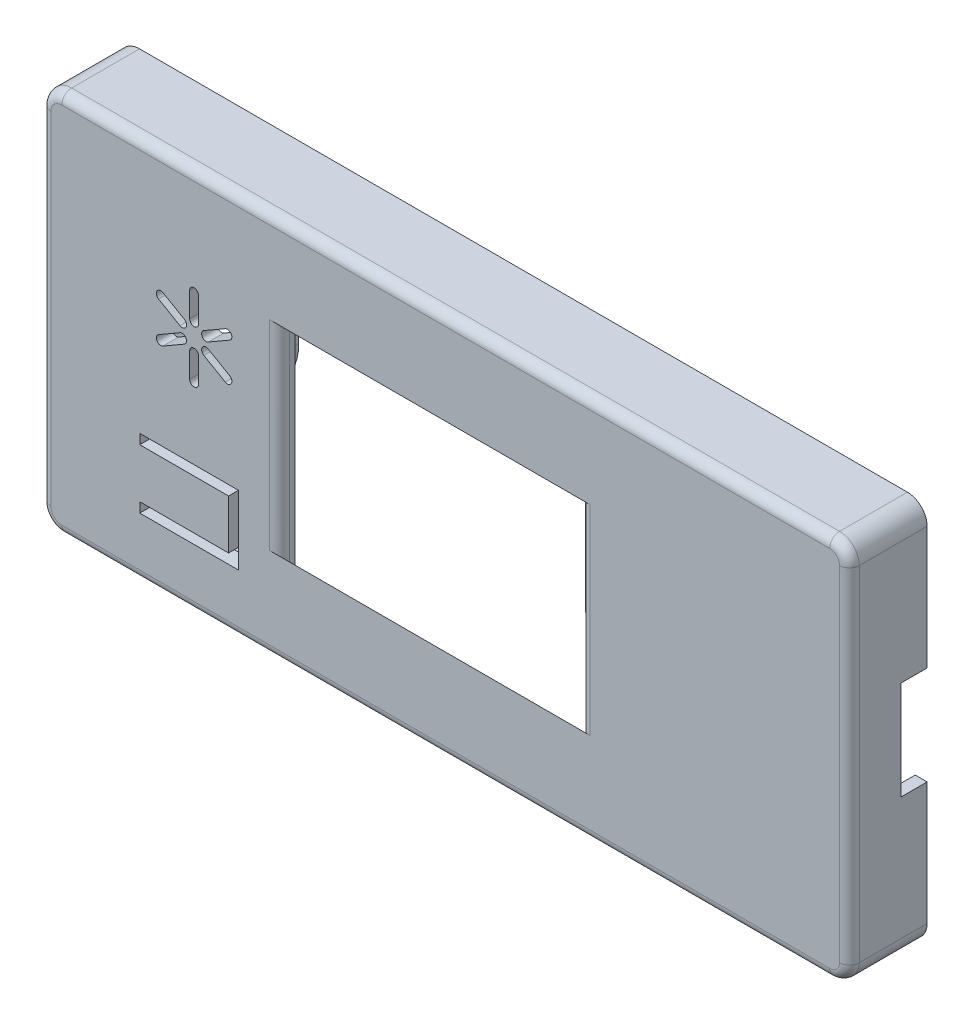
from build123d import *

# Parameters (mm, degrees)
SKIZZE1_W                            = 74
SKIZZE1_H                            = 33
AUFSATZ_LINEAR_AUSTRAGEN5_DEPTH      = 1.5
SCHNITT_LINEAR_AUSTRAGEN1_DEPTH      = 82.038571063
SCHNITT_LINEAR_AUSTRAGEN1_DEPTH_BACK = 82.038571063
SKIZZE1_10_W                         = 29
SKIZZE1_10_H                         = 27.2
SKIZZE1_23_W                         = 78
SKIZZE1_23_H                         = 37
SKIZZE1_23_W_2                       = 74
SKIZZE1_23_H_2                       = 33
AUFSATZ_LINEAR_AUSTRAGEN7_DEPTH      = 6
SKIZZE1_24_W                         = 78
SKIZZE1_24_H                         = 37
SKIZZE1_24_W_2                       = 74
SKIZZE1_24_H_2                       = 33
AUFSATZ_LINEAR_AUSTRAGEN8_DEPTH      = 1.5
SKIZZE13_W                           = 23.25
SKIZZE13_H                           = 33
SCHNITT_LINEAR_AUSTRAGEN10_DEPTH     = 1
SKIZZE14_W                           = 29
SKIZZE14_H                           = 1.5
SCHNITT_LINEAR_AUSTRAGEN11_DEPTH     = 8
SKIZZE16_W                           = 75.7
SKIZZE16_H                           = 34.7
SCHNITT_LINEAR_AUSTRAGEN12_DEPTH     = 2.5
VERRUNDUNG7_R                        = 2
SKALIEREN1_SCALE                     = 1.05
VERRUNDUNG10_R                       = 1
SKIZZE21_W                           = 30.828150055
SKIZZE21_H                           = 1.575
AUFSATZ_LINEAR_AUSTRAGEN14_DEPTH     = 6
FASE1_SIZE                           = 3
FASE1_SIZE_2                         = 1.732050808
SPIEGELN2_START                      = 20.391584861
SPIEGELN2_DEPTH                      = 30.45
VERRUNDUNG11_R                       = 1
VERRUNDUNG12_R                       = 2
SKIZZE23_W                           = 2.625
SKIZZE23_H                           = 10
SCHNITT_LINEAR_AUSTRAGEN13_DEPTH     = 1.2075
SCHNITT_LINEAR_AUSTRAGEN14_DEPTH     = 1.575
SKIZZE29_W                           = 9
SKIZZE29_H                           = 5
AUFSATZ_LINEAR_AUSTRAGEN16_DEPTH     = 1
SCHNITT_LINEAR_AUSTRAGEN16_DEPTH     = 1.618842947
AUFSATZ_LINEAR_AUSTRAGEN17_DEPTH     = 3.131157053
AUFSATZ_LINEAR_START                 = -3.131157053
AUFSATZ_LINEAR_AUSTRAGEN18_DEPTH     = 3.131157053


# Read off the part's stored shape, not the designer's step: Spiegeln2
with BuildPart() as part:
    # Skizze1 → Aufsatz-Linear austragen5 (new body)
    with BuildSketch(Plane.XY):
        with Locations((37, 16.5)):
            Rectangle(SKIZZE1_W, SKIZZE1_H)
    extrude(amount=AUFSATZ_LINEAR_AUSTRAGEN5_DEPTH)

    # Skizze1<10> → Schnitt-Linear austragen1 (cut, two sides: drawn at the far end of the back side and taken through both)
    with BuildSketch(Plane.XY.offset(-SCHNITT_LINEAR_AUSTRAGEN1_DEPTH_BACK)):
        with Locations((35.5, 16.5)):
            Rectangle(SKIZZE1_10_W, SKIZZE1_10_H)
    extrude(amount=SCHNITT_LINEAR_AUSTRAGEN1_DEPTH + SCHNITT_LINEAR_AUSTRAGEN1_DEPTH_BACK, mode=Mode.SUBTRACT)



with BuildPart() as body_2:
    # Skizze1<23> → Aufsatz-Linear austragen7 (new body)
    with BuildSketch(Plane.XY):
        with Locations((37, 16.5)):
            Rectangle(SKIZZE1_23_W, SKIZZE1_23_H)
        with Locations((37, 16.5)):
            Rectangle(SKIZZE1_23_W_2, SKIZZE1_23_H_2, mode=Mode.SUBTRACT)
    extrude(amount=-AUFSATZ_LINEAR_AUSTRAGEN7_DEPTH)


with BuildPart() as part_1:
    add(part.part)

    add(body_2.part)  # Aufsatz-Linear austragen8 merges body 2
    # Skizze1<24> → Aufsatz-Linear austragen8 (add)
    with BuildSketch(Plane.XY):
        with Locations((37, 16.5)):
            Rectangle(SKIZZE1_24_W, SKIZZE1_24_H)
        with Locations((37, 16.5)):
            Rectangle(SKIZZE1_24_W_2, SKIZZE1_24_H_2, mode=Mode.SUBTRACT)
    extrude(amount=AUFSATZ_LINEAR_AUSTRAGEN8_DEPTH)

    # Skizze13 → Schnitt-Linear austragen10 (cut)
    with BuildSketch(Plane(origin=(0, 0, 0), x_dir=(-1, 0, 0), z_dir=(0, 0, -1))):
        with Locations((-62.375, 16.5)):
            Rectangle(SKIZZE13_W, SKIZZE13_H)
    extrude(amount=-SCHNITT_LINEAR_AUSTRAGEN10_DEPTH, mode=Mode.SUBTRACT)

    # Skizze14 → Schnitt-Linear austragen11 (cut)
    with BuildSketch(Plane(origin=(0, 0, 0), x_dir=(-1, 0, 0), z_dir=(0, 0, -1))):
        with Locations((-35.5, 30.85)):
            Rectangle(SKIZZE14_W, SKIZZE14_H)
        with Locations((-35.5, 2.15)):
            Rectangle(SKIZZE14_W, SKIZZE14_H)
    extrude(amount=-SCHNITT_LINEAR_AUSTRAGEN11_DEPTH, mode=Mode.SUBTRACT)

    # Skizze16 → Schnitt-Linear austragen12 (cut)
    with BuildSketch(Plane(origin=(0, 0, -6), x_dir=(-1, 0, 0), z_dir=(0, 0, -1))):
        with Locations((-37, 16.5)):
            Rectangle(SKIZZE16_W, SKIZZE16_H)
    extrude(amount=-SCHNITT_LINEAR_AUSTRAGEN12_DEPTH, mode=Mode.SUBTRACT)

    # Verrundung7
    verrundung7_edges = [part_1.edges().sort_by_distance(p)[0] for p in [
        (-2, 35, -2.25),
        (-2, -2, -2.25),
    ]]
    fillet(verrundung7_edges, radius=VERRUNDUNG7_R)


with BuildPart() as part_2:
    # Skalieren1: scaled about (33.168302775, 16.5, -0.876858937)
    add(part_1.part.scale(SKALIEREN1_SCALE).moved(Location((-1.658415139, -0.825, 0.043842947))))

    # Verrundung10
    verrundung10_edges = [part_2.edges().sort_by_distance(p)[0] for p in [
        (-3.758415139, 16.5, 1.618842947),
        (38.241584861, 35.925, 1.618842947),
        (38.241584861, -2.925, 1.618842947),
        (-3.143339379, -2.30992424, 1.618842947),
        (-3.143339379, 35.30992424, 1.618842947),
        (78.141584861, 16.5, 1.618842947),
    ]]
    fillet(verrundung10_edges, radius=VERRUNDUNG10_R)

    # Skizze21 → Aufsatz-Linear austragen14 (add)
    with BuildSketch(Plane.XZ.offset(-32.355)):
        with Locations((35.805659889, 0.831342947)):
            Rectangle(SKIZZE21_W, SKIZZE21_H)
    extrude(amount=AUFSATZ_LINEAR_AUSTRAGEN14_DEPTH)

    # Fase1
    # the kernel refuses this chamfer: 3, 1.732050808 mm, written as the material it takes off along each edge
    with BuildSketch(Plane(origin=(50.841584861, 26.355, 0.043842947), x_dir=(0, 0.9998132206221872, -0.019326765613771852), z_dir=(-1, 0, 0))) as fase1_piece_1:
        Polygon((FASE1_SIZE * 0.999813220622, -FASE1_SIZE * 0.0193267656127), (-FASE1_SIZE_2 * 0.019326765609, -FASE1_SIZE_2 * 0.999813220373), (0, 0), align=None)
    extrude(amount=30.45, mode=Mode.SUBTRACT)

    # Spiegeln2 outline → Spiegeln2 (add)
    with BuildSketch(Plane.YZ.offset(SPIEGELN2_START)):
        Polygon((0.645, 0.043842947), (3.645, 0.043842947), (6.372980022, 1.618842947), (0.645, 1.618842947), align=None)
    extrude(amount=SPIEGELN2_DEPTH)

    # Verrundung11
    verrundung11_edges = [part_2.edges().sort_by_distance(p)[0] for p in [
        (50.841584861, 16.5, 1.618842947),
        (20.391584861, 16.5, 1.618842947),
    ]]
    fillet(verrundung11_edges, radius=VERRUNDUNG11_R)

    # Verrundung12
    # the kernel refuses this fillet: 2 mm, written as the material it takes off along each edge
    with BuildSketch(Plane(origin=(76.141584861, -0.925, 1.618842947), x_dir=(0, -1, 0), z_dir=(-1, 0, 0))) as verrundung12_piece_1:
        with BuildLine():
            CenterArc((1, -1), 1, 0, 90)
            Line((2, -1), (2, 0))
            Line((2, 0), (1, 0))
        make_face()
    revolve(axis=Axis((76.141584861, -0.925, 1.618842947), (0, 0, 1)), revolution_arc=90, mode=Mode.SUBTRACT)
    with BuildSketch(Plane(origin=(76.141584861, 33.925, 1.618842947), x_dir=(1, 0, 0), z_dir=(0, -1, 0))) as verrundung12_piece_2:
        with BuildLine():
            CenterArc((1, -1), 1, 0, 90)
            Line((2, -1), (2, 0))
            Line((2, 0), (1, 0))
        make_face()
    revolve(axis=Axis((76.141584861, 33.925, 1.618842947), (0, 0, 1)), revolution_arc=90, mode=Mode.SUBTRACT)
    with BuildSketch(Plane(origin=(78.141584861, -2.925, 1.618842947), x_dir=(0, 1, 0), z_dir=(0, 0, -1))) as verrundung12_piece_3:
        with BuildLine():
            CenterArc((VERRUNDUNG12_R, -VERRUNDUNG12_R), VERRUNDUNG12_R, 90, 90)
            Line((0, -VERRUNDUNG12_R), (0, 0))
            Line((0, 0), (VERRUNDUNG12_R, 0))
        make_face()
    extrude(amount=12.875, mode=Mode.SUBTRACT)
    with BuildSketch(Plane(origin=(78.141584861, 35.925, 1.618842947), x_dir=(0, -1, 0), z_dir=(0, 0, -1))) as verrundung12_piece_4:
        with BuildLine():
            CenterArc((VERRUNDUNG12_R, VERRUNDUNG12_R), VERRUNDUNG12_R, 180, 90)
            Line((0, VERRUNDUNG12_R), (0, 0))
            Line((0, 0), (VERRUNDUNG12_R, 0))
        make_face()
    extrude(amount=12.875, mode=Mode.SUBTRACT)

    # Skizze23 → Schnitt-Linear austragen13 (cut)
    with BuildSketch(Plane.ZY.offset(-76.934084861)):
        with Locations((-4.943657053, 16.5)):
            Rectangle(SKIZZE23_W, SKIZZE23_H)
    extrude(amount=-SCHNITT_LINEAR_AUSTRAGEN13_DEPTH, mode=Mode.SUBTRACT)

    # Skizze26 → Schnitt-Rotation1 (revolve, cut)
    with BuildSketch(Plane.XZ.offset(-34.7175)):
        with BuildLine():
            Line((16, -4.856157053), (37, -4.856157053))
            Line((37, -4.856157053), (37, -4.256157053))
            Line((37, -4.256157053), (16.6, -4.256157053))
            ThreePointArc((16.6, -4.256157053), (16.175735931, -4.431892984), (16, -4.856157053))
        make_face()
    schnitt_rotation1 = revolve(axis=Axis((16, 34.7175, -4.856157053), (1, 0, 0)), mode=Mode.SUBTRACT)

    # Spiegeln3: Schnitt-Rotation1 across plane
    add(schnitt_rotation1.mirror(Plane.ZY.offset(-37)), mode=Mode.SUBTRACT)

    # Spiegeln4: Schnitt-Rotation1 across plane
    add(schnitt_rotation1.mirror(Plane.ZX.offset(16.5)), mode=Mode.SUBTRACT)

    # Spiegeln4 copy 1 sketch → Spiegeln4 copy 1 (revolve, cut)
    with BuildSketch(Plane(origin=(74, -1.7175, 0), x_dir=(-1, 0, 0), z_dir=(0, 1, 0))):
        with BuildLine():
            Line((16, -4.856157053), (37, -4.856157053))
            Line((37, -4.856157053), (37, -4.256157053))
            Line((37, -4.256157053), (16.6, -4.256157053))
            ThreePointArc((16.6, -4.256157053), (16.175735931, -4.431892984), (16, -4.856157053))
        make_face()
    revolve(axis=Axis((58, -1.7175, -4.856157053), (-1, 0, 0)), mode=Mode.SUBTRACT)

    # Skizze27 → Schnitt-Linear austragen14 (cut)
    with BuildSketch(Plane.XY.offset(1.618842947)):
        Polygon((6.241584861, 10.075), (16.241584861, 10.075), (16.241584861, 3.075), (6.241584861, 3.075), (6.241584861, 4.075), (15.241584861, 4.075), (15.241584861, 9.075), (6.241584861, 9.075), align=None)
    extrude(amount=-SCHNITT_LINEAR_AUSTRAGEN14_DEPTH, mode=Mode.SUBTRACT)

    # Skizze1<36> → Schnitt-Linear austragen16 (cut)
    with BuildSketch(Plane.XY):
        with BuildLine():
            Line((8.597750966, 23.590144421), (10.762814476, 22.340144421))
            ThreePointArc((10.762814476, 22.340144421), (10.927525907, 21.725432989), (10.312814476, 21.560721557))
            Line((10.312814476, 21.560721557), (8.147750966, 22.810721557))
            ThreePointArc((8.147750966, 22.810721557), (7.983039534, 23.425432989), (8.597750966, 23.590144421))
        make_face()
        with BuildLine():
            Line((11.300946332, 25.149105086), (11.300946332, 22.649105086))
            ThreePointArc((11.300946332, 22.649105086), (11.750946332, 22.199105086), (12.200946332, 22.649105086))
            Line((12.200946332, 22.649105086), (12.200946332, 25.149105086))
            ThreePointArc((12.200946332, 25.149105086), (11.750946332, 25.599105086), (11.300946332, 25.149105086))
        make_face()
        with BuildLine():
            Line((14.902643555, 23.587549559), (12.737580045, 22.337549559))
            ThreePointArc((12.737580045, 22.337549559), (12.572868614, 21.722838128), (13.187580045, 21.558126696))
            Line((13.187580045, 21.558126696), (15.352643555, 22.808126696))
            ThreePointArc((15.352643555, 22.808126696), (15.517354987, 23.422838128), (14.902643555, 23.587549559))
        make_face()
        with BuildLine():
            Line((15.351145411, 19.687610505), (13.186081901, 20.937610505))
            ThreePointArc((13.186081901, 20.937610505), (12.57137047, 20.772899073), (12.736081901, 20.158187641))
            Line((12.736081901, 20.158187641), (14.901145411, 18.908187641))
            ThreePointArc((14.901145411, 18.908187641), (15.515856843, 19.072899073), (15.351145411, 19.687610505))
        make_face()
        with BuildLine():
            Line((12.197950045, 17.349226977), (12.197950045, 19.849226977))
            ThreePointArc((12.197950045, 19.849226977), (11.747950045, 20.299226977), (11.297950045, 19.849226977))
            Line((11.297950045, 19.849226977), (11.297950045, 17.349226977))
            ThreePointArc((11.297950045, 17.349226977), (11.747950045, 16.899226977), (12.197950045, 17.349226977))
        make_face()
        with BuildLine():
            Line((8.596252822, 18.910782503), (10.761316332, 20.160782503))
            ThreePointArc((10.761316332, 20.160782503), (10.926027763, 20.775493935), (10.311316332, 20.940205366))
            Line((10.311316332, 20.940205366), (8.146252822, 19.690205366))
            ThreePointArc((8.146252822, 19.690205366), (7.98154139, 19.075493935), (8.596252822, 18.910782503))
        make_face()
    extrude(amount=SCHNITT_LINEAR_AUSTRAGEN16_DEPTH, mode=Mode.SUBTRACT)


with BuildPart() as body_2_2:
    # Skizze29 → Aufsatz-Linear austragen16 (new body)
    with BuildSketch(Plane(origin=(0, 0, 0.043842947), x_dir=(-1, 0, 0), z_dir=(0, 0, -1))):
        with Locations((-10.741584861, 6.575)):
            Rectangle(SKIZZE29_W, SKIZZE29_H)
    extrude(amount=AUFSATZ_LINEAR_AUSTRAGEN16_DEPTH)


with BuildPart() as body_3:
    # Skizze1<38> → Aufsatz-Linear austragen17 (new body)
    with BuildSketch(Plane.XY):
        with BuildLine():
            ThreePointArc((17.6, 21.251), (11.75, 27.100000085), (5.9, 21.251))
            Line((5.9, 21.251), (7.400000115, 21.251))
            ThreePointArc((7.400000115, 21.251), (7.548424305, 22.376615144), (7.983068379, 23.425482972))
            ThreePointArc((7.983068379, 23.425482972), (12.875649235, 25.451834576), (16.099999885, 21.251))
            Line((16.099999885, 21.251), (17.6, 21.251))
        make_face()
    extrude(amount=-AUFSATZ_LINEAR_AUSTRAGEN17_DEPTH)

    # Skizze1<39> → Aufsatz-Linear austragen18 (add)
    with BuildSketch(Plane.XY.offset(AUFSATZ_LINEAR_START)):
        with BuildLine():
            Line((7.400000115, 21.251), (5.9, 21.251))
            ThreePointArc((5.9, 21.251), (11.75, 15.401999915), (17.6, 21.251))
            Line((17.6, 21.251), (16.099999885, 21.251))
            ThreePointArc((16.099999885, 21.251), (15.954866713, 20.137730767), (15.529646414, 19.09868326))
            ThreePointArc((15.529646414, 19.09868326), (15.515612726, 19.07247678), (15.499879375, 19.047254058))
            ThreePointArc((15.499879375, 19.047254058), (13.931904838, 17.48878445), (11.800380036, 16.902291751))
            ThreePointArc((11.800380036, 16.902291751), (11.747713679, 16.899227039), (11.695050571, 16.902347076))
            ThreePointArc((11.695050571, 16.902347076), (9.57009197, 17.487627412), (8.004784464, 19.039340833))
            ThreePointArc((8.004784464, 19.039340833), (7.981580622, 19.075425996), (7.961918578, 19.113556841))
            ThreePointArc((7.961918578, 19.113556841), (7.542951432, 20.145997131), (7.400000115, 21.251))
        make_face()
    extrude(amount=AUFSATZ_LINEAR_AUSTRAGEN18_DEPTH)


solid = Compound([part_2.part, body_2_2.part, body_3.part])
